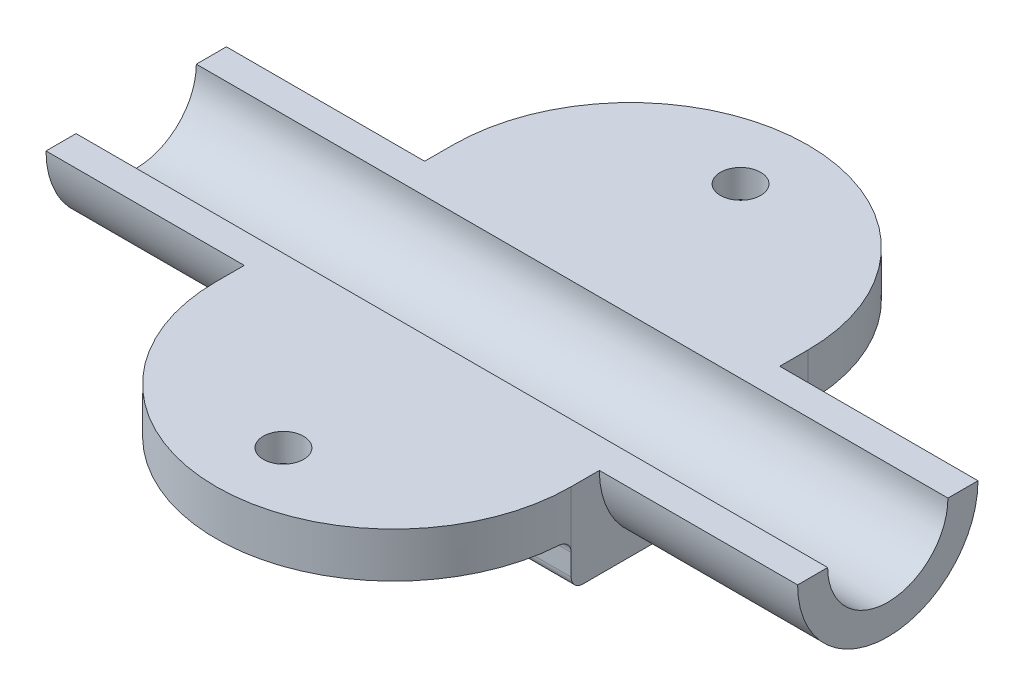
from build123d import *

# Parameters (mm, degrees)
SKETCH1_W                                           = 30
SKETCH1_H                                           = 30
BOSS_EXTRUDE1_DEPTH                                 = 7.62
BOSS_EXTRUDE2_DEPTH                                 = 16.75
CUT_EXTRUDE2_DEPTH                                  = 35.39570322
SKETCH3_W                                           = 30
SKETCH3_H                                           = 3.81
BOSS_EXTRUDE3_DEPTH                                 = 10
CSK_FOR_M3_COUNTERSUNK_FLAT_HEAD_SCREW1_D           = 3.4
CSK_FOR_M3_COUNTERSUNK_FLAT_HEAD_SCREW1_CSINK_D     = 6.3
CSK_FOR_M3_COUNTERSUNK_FLAT_HEAD_SCREW1_CSINK_ANGLE = 90
CUT_EXTRUDE3_START                                  = -10
CUT_EXTRUDE3_DEPTH                                  = 52.123313339
SKETCH6_W                                           = 30
SKETCH6_H                                           = 5
CUT_EXTRUDE5_DEPTH                                  = 3.81
FILLET1_R                                           = 1


with BuildPart() as part:
    # Sketch1 → Boss-Extrude1 (new body)
    with BuildSketch(Plane(origin=(0, 0, 0), x_dir=(1, 0, 0), z_dir=(0, 1, 0))):
        Rectangle(SKETCH1_W, SKETCH1_H)
    extrude(amount=BOSS_EXTRUDE1_DEPTH)

    # Sketch2 → Boss-Extrude2 (add)
    with BuildSketch(Plane(origin=(15, 0, 0), x_dir=(0, 0, -1), z_dir=(1, 0, 0))):
        with BuildLine():
            Line((-7.62, 7.62), (-5.08, 7.62))
            ThreePointArc((-5.08, 7.62), (0, 2.54), (5.08, 7.62))
            Line((5.08, 7.62), (7.62, 7.62))
            ThreePointArc((7.62, 7.62), (0, 0), (-7.62, 7.62))
        make_face()
    boss_extrude2 = extrude(amount=BOSS_EXTRUDE2_DEPTH)

    # Sketch2<4> → Cut-Extrude2 (cut, through all)
    with BuildSketch(Plane(origin=(15, 0, 0), x_dir=(0, 0, -1), z_dir=(1, 0, 0))):
        with BuildLine():
            Line((5.08, 7.62), (-5.08, 7.62))
            ThreePointArc((-5.08, 7.62), (0, 2.54), (5.08, 7.62))
        make_face()
    extrude(amount=-CUT_EXTRUDE2_DEPTH, mode=Mode.SUBTRACT)

    # Mirror1: Boss-Extrude2 across plane
    add(boss_extrude2.mirror(Plane(origin=(0, 0, 0), x_dir=(0, 0, 1), z_dir=(1, 0, 0))))

    # Sketch3 → Boss-Extrude3 (add)
    with BuildSketch(Plane.XY.offset(15)):
        with Locations((0, 5.715)):
            Rectangle(SKETCH3_W, SKETCH3_H)
    boss_extrude3 = extrude(amount=BOSS_EXTRUDE3_DEPTH)

    # CSK for M3 Countersunk Flat Head Screw1 (through all)
    with Locations(Plane(origin=(0, 3.81, 19.31), x_dir=(0, 0, -1), z_dir=(0, -1, 0))):
        with Locations((0, 0)):
            csk_for_m3_countersunk_flat_head_screw1 = CounterSinkHole(CSK_FOR_M3_COUNTERSUNK_FLAT_HEAD_SCREW1_D / 2, CSK_FOR_M3_COUNTERSUNK_FLAT_HEAD_SCREW1_CSINK_D / 2, counter_sink_angle=CSK_FOR_M3_COUNTERSUNK_FLAT_HEAD_SCREW1_CSINK_ANGLE)

    # Sketch4 → Cut-Extrude3 (cut)
    with BuildSketch(Plane(origin=(0, 7.62, 0), x_dir=(1, 0, 0), z_dir=(0, 1, 0)).offset(CUT_EXTRUDE3_START)):
        with BuildLine():
            Line((-15, -25), (-1.2e-08, -25))
            ThreePointArc((-1.2e-08, -25), (-10.606601722, -20.606601713), (-15, -10))
            Line((-15, -10), (-15, -25))
        make_face()
        with BuildLine():
            Line((15, -25), (15, -10))
            ThreePointArc((15, -10), (10.606601713, -20.606601722), (-1.2e-08, -25))
            Line((-1.2e-08, -25), (15, -25))
        make_face()
    cut_extrude3 = extrude(amount=CUT_EXTRUDE3_DEPTH, mode=Mode.SUBTRACT)

    # Mirror2: Boss-Extrude3, CSK for M3 Countersunk Flat Head Screw1, Cut-Extrude3 across plane
    add(boss_extrude3.mirror(Plane.XY))
    add(csk_for_m3_countersunk_flat_head_screw1.mirror(Plane.XY), mode=Mode.SUBTRACT)
    add(cut_extrude3.mirror(Plane.XY), mode=Mode.SUBTRACT)

    # Sketch6 → Cut-Extrude5 (cut)
    with BuildSketch(Plane.XZ):
        with Locations((0, 12.5)):
            Rectangle(SKETCH6_W, SKETCH6_H)
        with Locations((0, -12.5)):
            Rectangle(SKETCH6_W, SKETCH6_H)
    extrude(amount=-CUT_EXTRUDE5_DEPTH, mode=Mode.SUBTRACT)

    # Fillet1
    # the kernel refuses this fillet: 1 mm, written as the material it adds along each edge
    with BuildSketch(Plane(origin=(-17.5, 3.81, 10), x_dir=(0, 0, 1), z_dir=(1, 0, 0))) as fillet1_piece_1_section:
        with BuildLine():
            CenterArc((FILLET1_R, FILLET1_R), FILLET1_R, 180, 90)
            Line((0, FILLET1_R), (0, 0))
            Line((0, 0), (FILLET1_R, 0))
        make_face()
    fillet1_piece_1 = extrude(amount=35, mode=Mode.PRIVATE)
    fillet1_piece_1 = fillet1_piece_1 & Plane(origin=(0, 3.58660625, 10), x_dir=(-8.322182034394214e-10, 0, 1.0), z_dir=(0, -1, 0)) * Cylinder(15, 74, mode=Mode.PRIVATE)
    add(fillet1_piece_1)
    with BuildSketch(Plane(origin=(-17.5, 3.81, -10), x_dir=(0, 0, -1), z_dir=(1, 0, 0))) as fillet1_piece_2_section:
        with BuildLine():
            CenterArc((FILLET1_R, -FILLET1_R), FILLET1_R, 90, 90)
            Line((0, -FILLET1_R), (0, 0))
            Line((0, 0), (FILLET1_R, 0))
        make_face()
    fillet1_piece_2 = extrude(amount=35, mode=Mode.PRIVATE)
    fillet1_piece_2 = fillet1_piece_2 & Plane(origin=(0, 3.586606238, -10), x_dir=(1, 0, 0), z_dir=(0, -1, 0)) * Cylinder(15, 74, mode=Mode.PRIVATE)
    add(fillet1_piece_2)
    # the kernel refuses this fillet: 1 mm, written as the material it takes off along each edge
    with BuildSketch(Plane(origin=(-17.5, 0, 10), x_dir=(0, 1, 0), z_dir=(1, 0, 0)), Plane(origin=(-17.5, 0, -10), x_dir=(0, 0, 1), z_dir=(1, 0, 0))) as fillet1_2_piece_1:
        with BuildLine():
            CenterArc((FILLET1_R, -FILLET1_R), FILLET1_R, 90, 90)
            Line((0, -FILLET1_R), (0, 0))
            Line((0, 0), (FILLET1_R, 0))
        make_face()
    extrude(amount=35, mode=Mode.SUBTRACT)


solid = part.part
